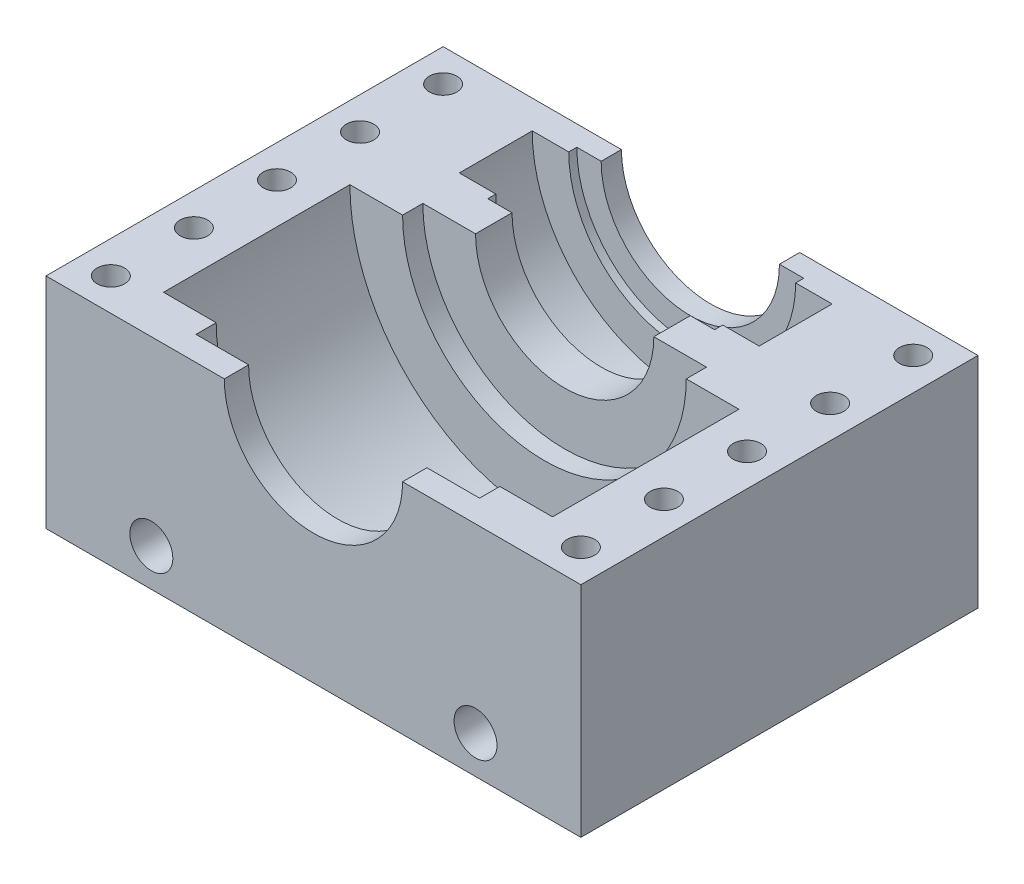
from build123d import *

# Parameters (mm, degrees)
PILLOW_SKETCH_W                                  = 22
PILLOW_SKETCH_H                                  = 49
PILLOW_SKETCH_W_2                                = 11
BASE_BOSS_EXTRUDE_DEPTH                          = 27
PILLOW_SKETCH_4_W                                = 11
PILLOW_SKETCH_4_H                                = 49
THRUST_START                                     = -4
THRUST_BEARING_STACK_CUT_REVOLVE_DEPTH           = 23
THRUST_START_2                                   = -6.5
THRUST_BEARING_STACK_CUT_REVOLVE_2_DEPTH         = 28
PILLOW_SKETCH_6_W                                = 14
PILLOW_SKETCH_6_H                                = 1
CBORE_FOR_M3_PAN_HEAD_MACHINE_SCREW1_D           = 3.4
CBORE_FOR_M3_PAN_HEAD_MACHINE_SCREW1_CBORE_D     = 7
CBORE_FOR_M3_PAN_HEAD_MACHINE_SCREW1_CBORE_DEPTH = 24
STEPPER_PLATE_MOUNT_M5_CLEARANCE_HOLE_D          = 5.3


# Read off the part's stored shape, not the designer's step: Thrust Bearing Stack Cut-Revolve
with BuildPart() as part:
    # Pillow Sketch → Base Boss-Extrude (new body)
    with BuildSketch(Plane(origin=(0, 0, 0), x_dir=(1, 0, 0), z_dir=(0, 1, 0))):
        with Locations((-22, 0)):
            Rectangle(PILLOW_SKETCH_W, PILLOW_SKETCH_H)
        with Locations((-5.5, 0)):
            Rectangle(PILLOW_SKETCH_W_2, PILLOW_SKETCH_H)
    base_boss_extrude = extrude(amount=-BASE_BOSS_EXTRUDE_DEPTH)

    # Pillow Sketch<4> → Shaft Clearance Cut-Revolve (revolve, cut)
    with BuildSketch(Plane(origin=(0, 0, 0), x_dir=(1, 0, 0), z_dir=(0, 1, 0))):
        with Locations((-5.5, 0)):
            Rectangle(PILLOW_SKETCH_4_W, PILLOW_SKETCH_4_H)
    shaft_clearance_cut_revolve = revolve(axis=Axis((0, 0, -24.5), (0, 0, 1)), mode=Mode.SUBTRACT)

    # Thrust Bearing Stack Cut-Revolve outline → Thrust Bearing Stack Cut-Revolve (cut)
    with BuildSketch(Plane.XY.offset(THRUST_START)):
        with BuildLine():
            ThreePointArc((-24, 0), (-16.970562748, -16.970562748), (0, -24))
            Line((0, -24), (0, -11))
            ThreePointArc((0, -11), (-7.778174593, -7.778174593), (-11, 0))
            Line((-11, 0), (-24, 0))
        make_face()
    thrust_bearing_stack_cut_revolve = extrude(amount=THRUST_BEARING_STACK_CUT_REVOLVE_DEPTH, mode=Mode.SUBTRACT)

    # Thrust Bearing Stack Cut-Revolve 2 outli → Thrust Bearing Stack Cut-Revolve 2 (cut)
    with BuildSketch(Plane.XY.offset(THRUST_START_2)):
        with BuildLine():
            ThreePointArc((-17.5, 0), (-12.374368671, -12.374368671), (0, -17.5))
            Line((0, -17.5), (0, -11))
            ThreePointArc((0, -11), (-7.778174593, -7.778174593), (-11, 0))
            Line((-11, 0), (-17.5, 0))
        make_face()
    thrust_bearing_stack_cut_revolve_2 = extrude(amount=THRUST_BEARING_STACK_CUT_REVOLVE_2_DEPTH, mode=Mode.SUBTRACT)

    # Pillow Sketch<6> → Rotary Bearing Cut-Revolve (revolve, cut)
    with BuildSketch(Plane(origin=(0, 0, 0), x_dir=(1, 0, 0), z_dir=(0, 1, 0))):
        Polygon((14, 21), (0, 21), (0, 12), (14, 12), (18.5, 12), (18.5, 21), align=None)
        with Locations((7, 21.5)):
            Rectangle(PILLOW_SKETCH_6_W, PILLOW_SKETCH_6_H)
        with Locations((7, 11.5)):
            Rectangle(PILLOW_SKETCH_6_W, PILLOW_SKETCH_6_H)
    rotary_bearing_cut_revolve = revolve(axis=Axis((0, 0, -24.5), (0, 0, 1)), mode=Mode.SUBTRACT)

    # CBORE for M3 Pan Head Machine Screw1 (through all)
    with Locations(Plane(origin=(0, -27, 0), x_dir=(-1, 0, 0), z_dir=(0, -1, 0))):
        with Locations((29, -20.5), (29, -10.25), (29, 0), (29, 10.25), (29, 20.5)):
            cbore_for_m3_pan_head_machine_screw1 = CounterBoreHole(CBORE_FOR_M3_PAN_HEAD_MACHINE_SCREW1_D / 2, CBORE_FOR_M3_PAN_HEAD_MACHINE_SCREW1_CBORE_D / 2, CBORE_FOR_M3_PAN_HEAD_MACHINE_SCREW1_CBORE_DEPTH)

    # Cover Mirror: Base Boss-Extrude, Shaft Clearance Cut-Revolve, Thrust Bearing Stack Cut-Revolve, Thrust Bearing Stack Cut-Revolve 2, Rotary Bearing Cut-Revolve, CBORE for M3 Pan Head Machine Screw1 across plane
    add(base_boss_extrude.mirror(Plane(origin=(0, 0, 0), x_dir=(0, 0, 1), z_dir=(1, 0, 0))))
    add(shaft_clearance_cut_revolve.mirror(Plane(origin=(0, 0, 0), x_dir=(0, 0, 1), z_dir=(1, 0, 0))), mode=Mode.SUBTRACT)
    add(thrust_bearing_stack_cut_revolve.mirror(Plane(origin=(0, 0, 0), x_dir=(0, 0, 1), z_dir=(1, 0, 0))), mode=Mode.SUBTRACT)
    add(thrust_bearing_stack_cut_revolve_2.mirror(Plane(origin=(0, 0, 0), x_dir=(0, 0, 1), z_dir=(1, 0, 0))), mode=Mode.SUBTRACT)
    add(rotary_bearing_cut_revolve.mirror(Plane(origin=(0, 0, 0), x_dir=(0, 0, 1), z_dir=(1, 0, 0))), mode=Mode.SUBTRACT)
    add(cbore_for_m3_pan_head_machine_screw1.mirror(Plane(origin=(0, 0, 0), x_dir=(0, 0, 1), z_dir=(1, 0, 0))), mode=Mode.SUBTRACT)

    # Stepper Plate Mount M5 Clearance Hole (through all)
    with Locations(Plane.XY.offset(24.5)):
        with Locations((-20, -22.360679775), (20, -22.360679775)):
            Hole(STEPPER_PLATE_MOUNT_M5_CLEARANCE_HOLE_D / 2)


solid = part.part
